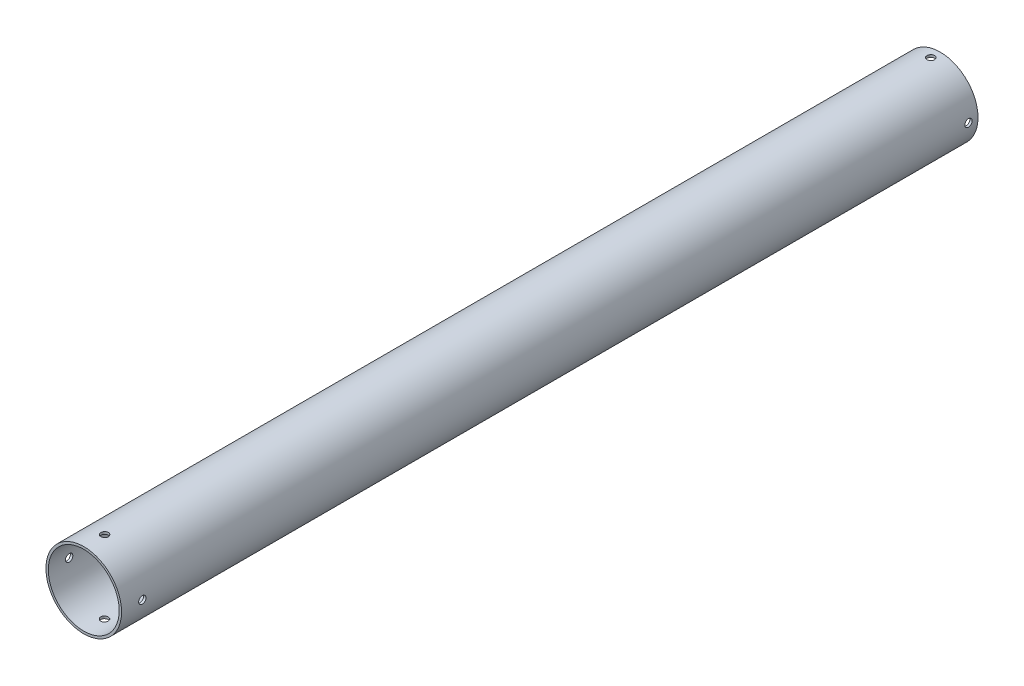
from build123d import *

# Parameters (mm, degrees)
SKETCH1_R               = 25.4
SKETCH1_R_2             = 23.8125
BOSS_EXTRUDE1_DEPTH     = 287.606496287
CUT_EXTRUDE1_DEPTH      = 290.84101971
CUT_EXTRUDE1_DEPTH_BACK = 290.84101971
SKETCH2_R               = 2.4892
CUT_EXTRUDE2_DEPTH      = 290.841019827
CUT_EXTRUDE2_DEPTH_BACK = 290.841019827
SKETCH3_R               = 2.4892
CUT_EXTRUDE3_DEPTH      = 290.841019827
CUT_EXTRUDE3_DEPTH_BACK = 290.841019827
SKETCH4_R               = 2.4892
CUT_EXTRUDE4_DEPTH      = 290.841019827
CUT_EXTRUDE4_DEPTH_BACK = 290.841019827
SKETCH5_R               = 2.4892


with BuildPart() as part:
    # Sketch1 → Boss-Extrude1 (new, symmetric)
    with BuildSketch(Plane.XY):
        Circle(SKETCH1_R)
        Circle(SKETCH1_R_2, mode=Mode.SUBTRACT)
    extrude(amount=BOSS_EXTRUDE1_DEPTH, both=True)

    # Sketch2 → Cut-Extrude1 (cut, two sides: drawn at the far end of the back side and taken through both)
    with BuildSketch(Plane(origin=(0, 0, 0), x_dir=(0, 0, -1), z_dir=(1, 0, 0)).offset(-CUT_EXTRUDE1_DEPTH_BACK)):
        with Locations((281.256496287, 0)):
            Circle(SKETCH2_R)
    extrude(amount=CUT_EXTRUDE1_DEPTH + CUT_EXTRUDE1_DEPTH_BACK, mode=Mode.SUBTRACT)

    # Sketch3 → Cut-Extrude2 (cut, two sides: drawn at the far end of the back side and taken through both)
    with BuildSketch(Plane(origin=(0, 0, 0), x_dir=(1, 0, 0), z_dir=(0, 1, 0)).offset(-CUT_EXTRUDE2_DEPTH_BACK)):
        with Locations((0, 281.256496287)):
            Circle(SKETCH3_R)
    extrude(amount=CUT_EXTRUDE2_DEPTH + CUT_EXTRUDE2_DEPTH_BACK, mode=Mode.SUBTRACT)

    # Sketch4 → Cut-Extrude3 (cut, two sides: drawn at the far end of the back side and taken through both)
    with BuildSketch(Plane(origin=(0, 0, 0), x_dir=(1, 0, 0), z_dir=(0, 1, 0)).offset(-CUT_EXTRUDE3_DEPTH_BACK)):
        with Locations((0, -273.636496287)):
            Circle(SKETCH4_R)
    extrude(amount=CUT_EXTRUDE3_DEPTH + CUT_EXTRUDE3_DEPTH_BACK, mode=Mode.SUBTRACT)

    # Sketch5 → Cut-Extrude4 (cut, two sides: drawn at the far end of the back side and taken through both)
    with BuildSketch(Plane(origin=(0, 0, 0), x_dir=(0, 0, -1), z_dir=(1, 0, 0)).offset(-CUT_EXTRUDE4_DEPTH_BACK)):
        with Locations((-273.636496287, 0)):
            Circle(SKETCH5_R)
    extrude(amount=CUT_EXTRUDE4_DEPTH + CUT_EXTRUDE4_DEPTH_BACK, mode=Mode.SUBTRACT)


solid = part.part
